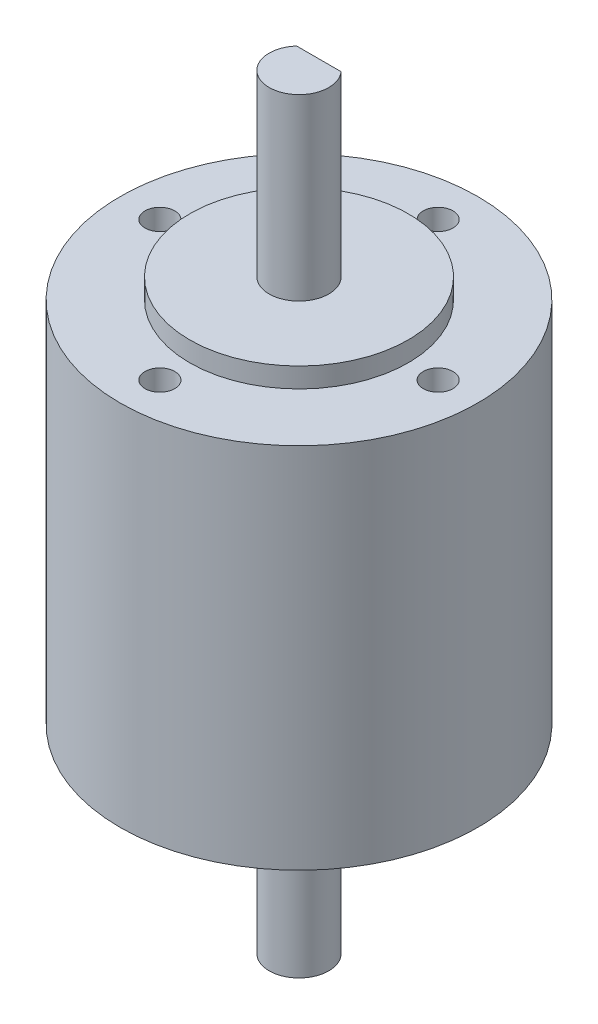
from build123d import *

# Parameters (mm, degrees)
SKETCH1_R           = 18
BOSS_EXTRUDE1_DEPTH = 18.5
SKETCH2_R           = 11
BOSS_EXTRUDE2_DEPTH = 2
SKETCH3_R           = 3
BOSS_EXTRUDE4_DEPTH = 18
CUT_EXTRUDE1_START  = -15
CUT_EXTRUDE1_DEPTH  = 15
SKETCH5_R           = 1.5
CUT_EXTRUDE2_DEPTH  = 4


with BuildPart() as part:
    # Sketch1 → Boss-Extrude1 (new, symmetric)
    with BuildSketch(Plane(origin=(0, 0, 0), x_dir=(1, 0, 0), z_dir=(0, 1, 0))):
        Circle(SKETCH1_R)
    extrude(amount=BOSS_EXTRUDE1_DEPTH, both=True)

    # Sketch2 → Boss-Extrude2 (add)
    with BuildSketch(Plane(origin=(0, 18.5, 0), x_dir=(1, 0, 0), z_dir=(0, 1, 0))):
        Circle(SKETCH2_R)
    boss_extrude2 = extrude(amount=BOSS_EXTRUDE2_DEPTH)

    # Sketch3 → Boss-Extrude4 (add)
    with BuildSketch(Plane(origin=(0, 20.5, 0), x_dir=(1, 0, 0), z_dir=(0, 1, 0))):
        Circle(SKETCH3_R)
    boss_extrude4 = extrude(amount=BOSS_EXTRUDE4_DEPTH)

    # Sketch4 → Cut-Extrude1 (cut)
    with BuildSketch(Plane(origin=(0, 38.5, 0), x_dir=(1, 0, 0), z_dir=(0, 1, 0)).offset(CUT_EXTRUDE1_START)):
        with BuildLine():
            Line((-2.236067977, 2), (2.236067977, 2))
            ThreePointArc((2.236067977, 2), (0, 3), (-2.236067977, 2))
        make_face()
    cut_extrude1 = extrude(amount=CUT_EXTRUDE1_DEPTH, mode=Mode.SUBTRACT)

    # Sketch5 → Cut-Extrude2 (cut)
    with BuildSketch(Plane(origin=(0, 18.5, 0), x_dir=(1, 0, 0), z_dir=(0, 1, 0))):
        with Locations((0, 14)):
            Circle(SKETCH5_R)
        with Locations((-14, 0)):
            Circle(SKETCH5_R)
        with Locations((0, -14)):
            Circle(SKETCH5_R)
        with Locations((14, 0)):
            Circle(SKETCH5_R)
    cut_extrude2 = extrude(amount=-CUT_EXTRUDE2_DEPTH, mode=Mode.SUBTRACT)

    # Mirror1: Boss-Extrude2, Boss-Extrude4, Cut-Extrude1, Cut-Extrude2 across plane
    add(boss_extrude2.mirror(Plane.ZX))
    add(boss_extrude4.mirror(Plane.ZX))
    add(cut_extrude1.mirror(Plane.ZX), mode=Mode.SUBTRACT)
    add(cut_extrude2.mirror(Plane.ZX), mode=Mode.SUBTRACT)


solid = part.part
